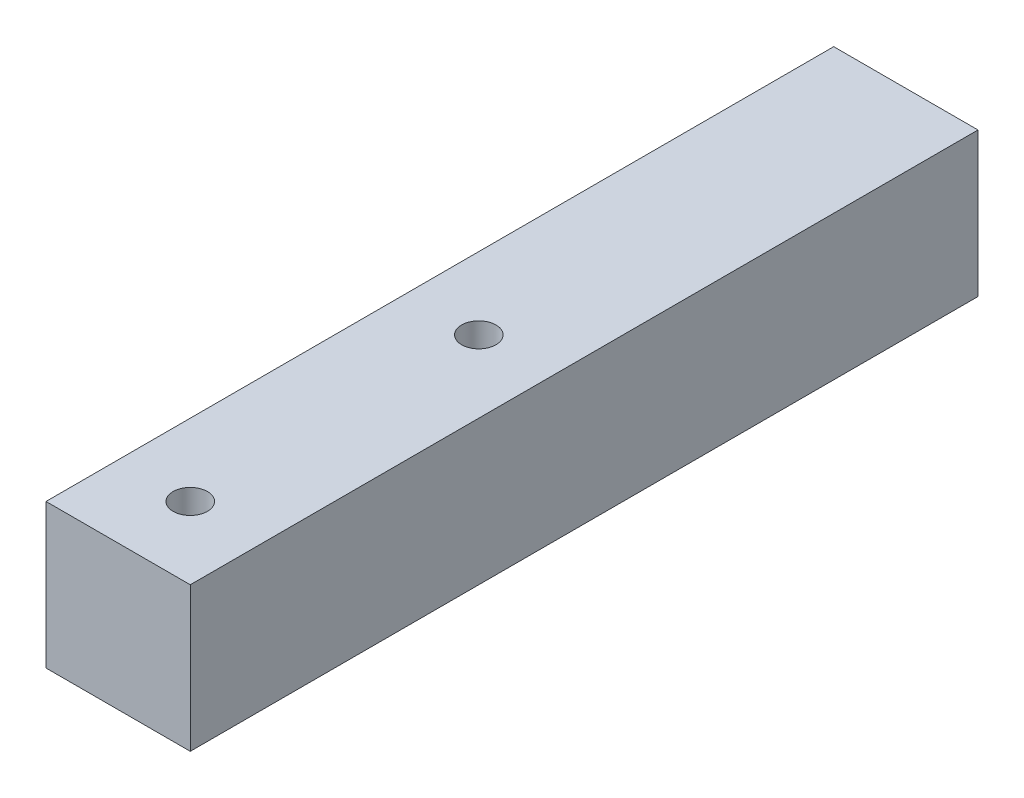
from build123d import *

# Parameters (mm, degrees)
SKETCH1_W                    = 25.4
SKETCH1_H                    = 25.4
BOSS_EXTRUDE1_DEPTH          = 69.341499747
F_6_05_6_05_DIAMETER_HOLE1_D = 6.05


with BuildPart() as part:
    # Sketch1 → Boss-Extrude1 (new, symmetric)
    with BuildSketch(Plane.XY):
        Rectangle(SKETCH1_W, SKETCH1_H)
    extrude(amount=BOSS_EXTRUDE1_DEPTH, both=True)

    # Ø6.05 (6.05) Diameter Hole1 (through all)
    with Locations(Plane(origin=(0, -12.7, 0), x_dir=(-1, 0, 0), z_dir=(0, -1, 0))):
        with Locations((0, -5.841499747), (0, -56.641499747)):
            Hole(F_6_05_6_05_DIAMETER_HOLE1_D / 2)


solid = part.part
